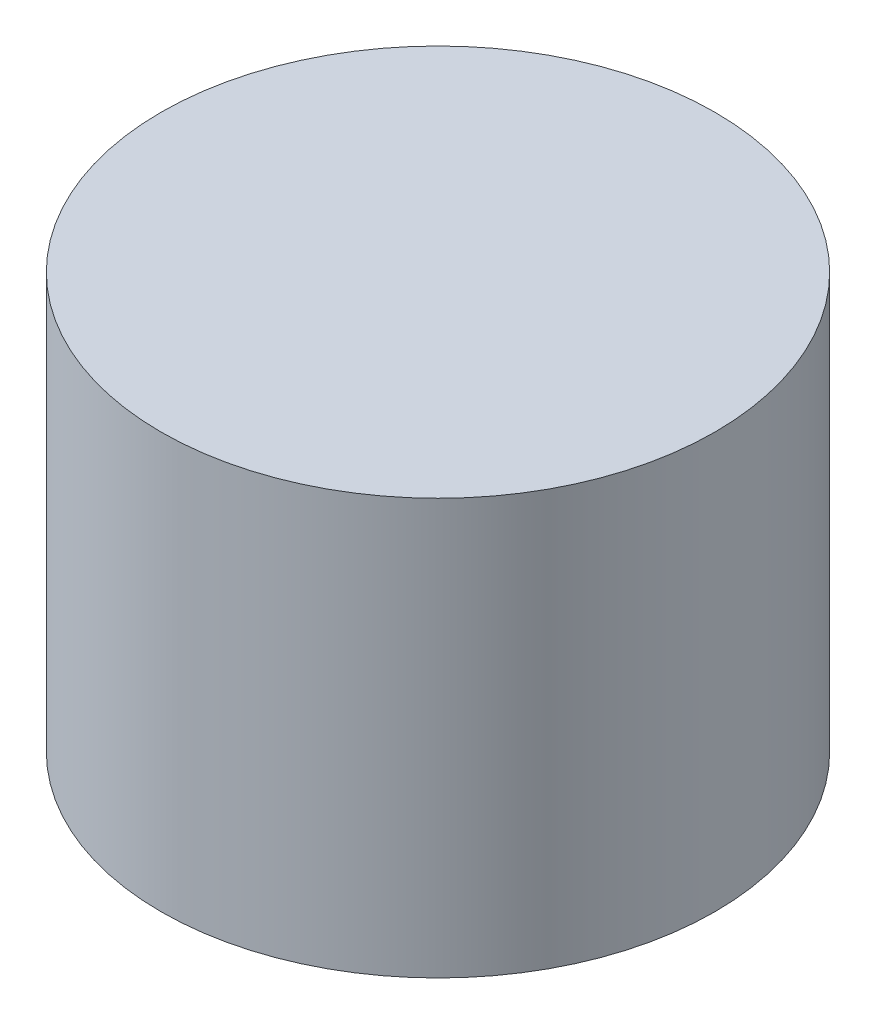
from build123d import *

# Parameters (mm, degrees)
SKETCH1_R           = 10
BOSS_EXTRUDE1_DEPTH = 15


with BuildPart() as part:
    # Sketch1 → Boss-Extrude1 (new body)
    with BuildSketch(Plane(origin=(0, 0, 0), x_dir=(1, 0, 0), z_dir=(0, 1, 0))):
        Circle(SKETCH1_R)
    extrude(amount=BOSS_EXTRUDE1_DEPTH)


solid = part.part
